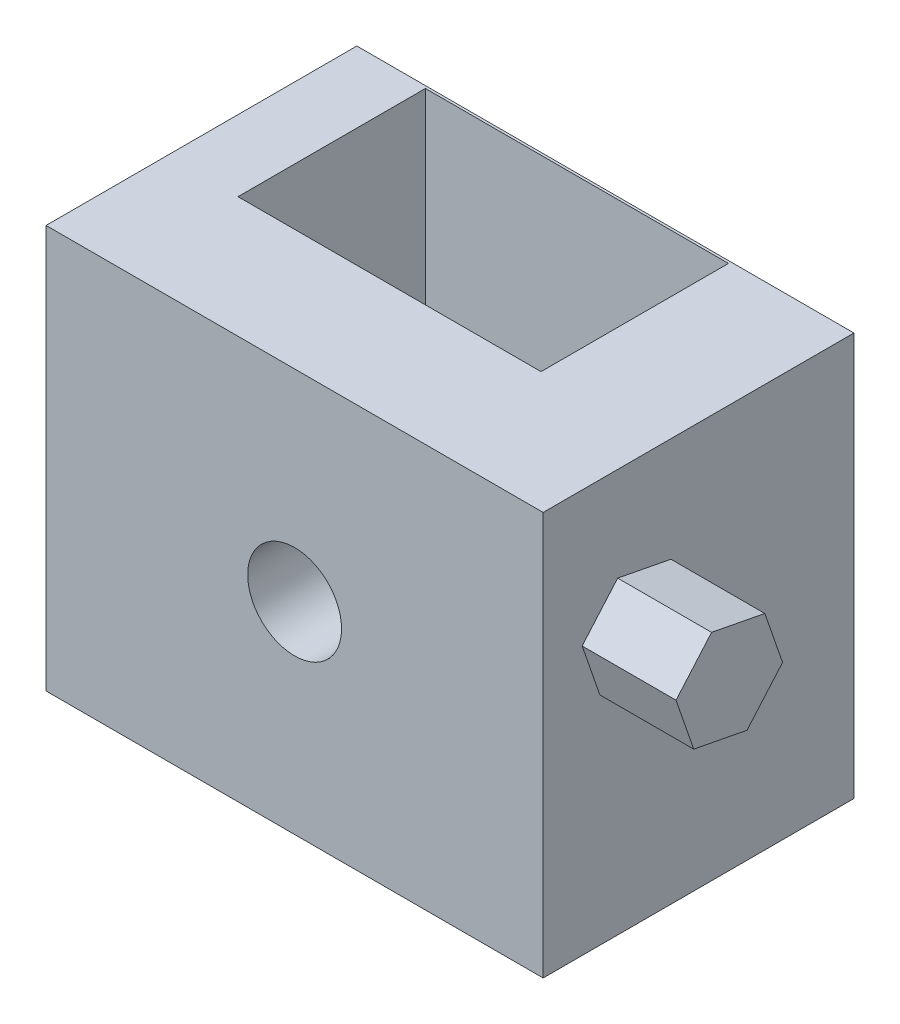
from build123d import *

# Parameters (mm, degrees)
SKETCH2_W           = 134.477697302
SKETCH2_H           = 109.076354478
BOSS_EXTRUDE1_DEPTH = 84.074
SKETCH3_R           = 12.7
CUT_EXTRUDE1_DEPTH  = 127
SKETCH4_W           = 81.978128355
SKETCH4_H           = 50.707128689
CUT_EXTRUDE2_DEPTH  = 104.14
BOSS_EXTRUDE2_DEPTH = 25.4


with BuildPart() as part:
    # Sketch2 → Boss-Extrude1 (new body)
    with BuildSketch(Plane.XY):
        Rectangle(SKETCH2_W, SKETCH2_H)
    extrude(amount=BOSS_EXTRUDE1_DEPTH)

    # Sketch3 → Cut-Extrude1 (cut)
    with BuildSketch(Plane.XY.offset(84.074)):
        Circle(SKETCH3_R)
    extrude(amount=-CUT_EXTRUDE1_DEPTH, mode=Mode.SUBTRACT)

    # Sketch4 → Cut-Extrude2 (cut)
    with BuildSketch(Plane(origin=(0, 54.538177239, 0), x_dir=(1, 0, 0), z_dir=(0, 1, 0))):
        with Locations((-7.023947617, -26.021677284)):
            Rectangle(SKETCH4_W, SKETCH4_H)
    extrude(amount=-CUT_EXTRUDE2_DEPTH, mode=Mode.SUBTRACT)

    # Sketch5 → Boss-Extrude2 (add)
    with BuildSketch(Plane(origin=(67.238848651, 0, 0), x_dir=(0, 0, -1), z_dir=(1, 0, 0))):
        Polygon((-54.326321663, 1.325818935), (-44.711130396, 12.412030691), (-49.504475775, 26.282136468), (-63.913012421, 29.06603049), (-73.528203689, 17.979818734), (-68.734858309, 4.109712956), align=None)
    extrude(amount=BOSS_EXTRUDE2_DEPTH)


solid = part.part
